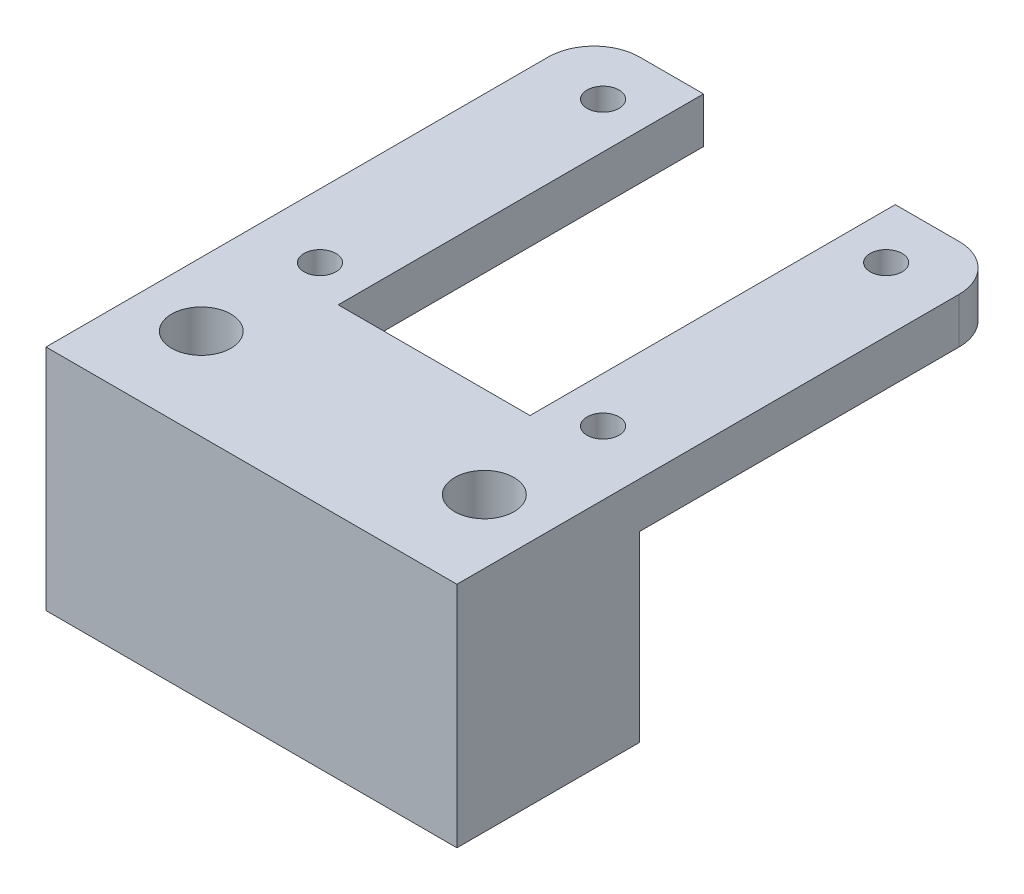
from build123d import *

# Parameters (mm, degrees)
SKETCH1_W                                           = 45
SKETCH1_H                                           = 20
BOSS_EXTRUDE1_DEPTH                                 = 25
SKETCH2_W                                           = 12
SKETCH2_H                                           = 5
BOSS_EXTRUDE2_DEPTH                                 = 40
SKETCH3_R                                           = 1.75
CUT_EXTRUDE1_DEPTH                                  = 61.259853966
SKETCH4_R                                           = 1.75
CUT_EXTRUDE2_DEPTH                                  = 25
CBORE_FOR_M3_HEX_SOCKET_HEAD_CAP_SCREW1_D           = 3.4
CBORE_FOR_M3_HEX_SOCKET_HEAD_CAP_SCREW1_CBORE_D     = 6.5
CBORE_FOR_M3_HEX_SOCKET_HEAD_CAP_SCREW1_CBORE_DEPTH = 11.4
CBORE_FOR_M3_HEX_SOCKET_HEAD_CAP_SCR_2_COUNT        = 2
CBORE_FOR_M3_HEX_SOCKET_HEAD_CAP_SCR_2_PITCH        = 31
CBORE_FOR_M3_HEX_SOCKET_HEAD_CAP_SCR_3_COUNT        = 2
CBORE_FOR_M3_HEX_SOCKET_HEAD_CAP_SCR_3_PITCH        = 43.840620434
CBORE_FOR_M3_HEX_SOCKET_HEAD_CAP_SCR_4_COUNT        = 2
CBORE_FOR_M3_HEX_SOCKET_HEAD_CAP_SCR_4_PITCH        = 31
FILLET1_R                                           = 5


with BuildPart() as part:
    # Sketch1 → Boss-Extrude1 (new body)
    with BuildSketch(Plane(origin=(0, 0, 0), x_dir=(1, 0, 0), z_dir=(0, 1, 0))):
        Rectangle(SKETCH1_W, SKETCH1_H)
    extrude(amount=BOSS_EXTRUDE1_DEPTH)

    # Sketch2 → Boss-Extrude2 (add)
    with BuildSketch(Plane(origin=(0, 0, -10), x_dir=(-1, 0, 0), z_dir=(0, 0, -1))):
        with Locations((-16.5, 22.5)):
            Rectangle(SKETCH2_W, SKETCH2_H)
        with Locations((16.5, 22.5)):
            Rectangle(SKETCH2_W, SKETCH2_H)
    extrude(amount=BOSS_EXTRUDE2_DEPTH)

    # Sketch3 → Cut-Extrude1 (cut, through all)
    with BuildSketch(Plane(origin=(0, 25, 0), x_dir=(1, 0, 0), z_dir=(0, 1, 0))):
        with Locations((15.5, 44)):
            Circle(SKETCH3_R)
        with Locations((15.5, 13)):
            Circle(SKETCH3_R)
        with Locations((-15.5, 13)):
            Circle(SKETCH3_R)
        with Locations((-15.5, 44)):
            Circle(SKETCH3_R)
    extrude(amount=-CUT_EXTRUDE1_DEPTH, mode=Mode.SUBTRACT)

    # Sketch4 → Cut-Extrude2 (cut)
    with BuildSketch(Plane(origin=(0, 25, 0), x_dir=(1, 0, 0), z_dir=(0, 1, 0))):
        with Locations((-15.5, 0)):
            Circle(SKETCH4_R)
        with Locations((15.5, 0)):
            Circle(SKETCH4_R)
    extrude(amount=-CUT_EXTRUDE2_DEPTH, mode=Mode.SUBTRACT)

    # CBORE for M3 Hex Socket Head Cap Screw1 (through all)
    with Locations(Plane(origin=(0, 25, 0), x_dir=(1, 0, 0), z_dir=(0, 1, 0))):
        with Locations((15.5, 0), (-15.5, 0)):
            CounterBoreHole(CBORE_FOR_M3_HEX_SOCKET_HEAD_CAP_SCREW1_D / 2, CBORE_FOR_M3_HEX_SOCKET_HEAD_CAP_SCREW1_CBORE_D / 2, CBORE_FOR_M3_HEX_SOCKET_HEAD_CAP_SCREW1_CBORE_DEPTH)

    # Sketch8 → CBORE for M3 Hex Socket Head Cap Screw2 (revolve, cut)
    with BuildSketch(Plane(origin=(-15.5, 20, -44), x_dir=(0, 0, -1), z_dir=(1, 0, 0))):
        Polygon((0, 0), (0, 5), (1.7, 5), (1.7, 2), (3.25, 2), (3.25, 0), align=None)
    cbore_for_m3_hex_socket_head_cap_screw2 = revolve(axis=Axis((-15.5, 13.65, -44), (0, 1, 0)), mode=Mode.SUBTRACT)

    # CBORE for M3 Hex Socket Head Cap Scr 2: CBORE for M3 Hex Socket Head Cap Screw2 ×2
    with Locations(*[(0, 0, i * CBORE_FOR_M3_HEX_SOCKET_HEAD_CAP_SCR_2_PITCH) for i in range(1, CBORE_FOR_M3_HEX_SOCKET_HEAD_CAP_SCR_2_COUNT)]):
        add(cbore_for_m3_hex_socket_head_cap_screw2, mode=Mode.SUBTRACT)

    # CBORE for M3 Hex Socket Head Cap Scr 3: CBORE for M3 Hex Socket Head Cap Screw2 ×2
    with Locations(*[Vector(0.7071067811865475, 0, 0.7071067811865476) * (i * CBORE_FOR_M3_HEX_SOCKET_HEAD_CAP_SCR_3_PITCH) for i in range(1, CBORE_FOR_M3_HEX_SOCKET_HEAD_CAP_SCR_3_COUNT)]):
        add(cbore_for_m3_hex_socket_head_cap_screw2, mode=Mode.SUBTRACT)

    # CBORE for M3 Hex Socket Head Cap Scr 4: CBORE for M3 Hex Socket Head Cap Screw2 ×2
    with Locations(*[(i * CBORE_FOR_M3_HEX_SOCKET_HEAD_CAP_SCR_4_PITCH, 0, 0) for i in range(1, CBORE_FOR_M3_HEX_SOCKET_HEAD_CAP_SCR_4_COUNT)]):
        add(cbore_for_m3_hex_socket_head_cap_screw2, mode=Mode.SUBTRACT)

    # Fillet1
    fillet1_edges = [part.edges().sort_by_distance(p)[0] for p in [
        (22.5, 22.5, -50),
        (-22.5, 22.5, -50),
    ]]
    fillet(fillet1_edges, radius=FILLET1_R)


solid = part.part
